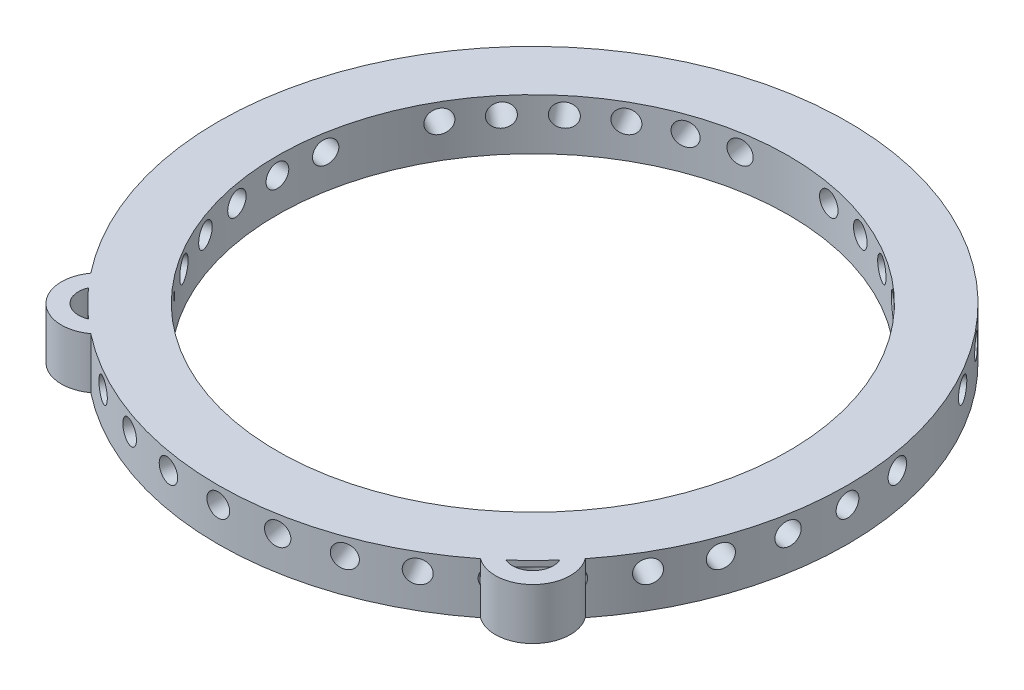
from build123d import *
from build123d.topology import SkipClean

# Parameters (mm, degrees)
CORTAR_EXTRUIR1_REACH      = 64.102
CORTAR_EXTRUIR1_END_RADIUS = 22.5
CROQUIS3_R                 = 1
MATRIZC1_COUNT             = 36
CROQUIS5_R                 = 1.8
CORTAR_EXTRUIR2_DEPTH      = 4
CROQUIS6_R                 = 3.3
CROQUIS6_R_2               = 1.8
SALIENTE_EXTRUIR1_DEPTH    = 3
SALIENTE_EXTRUIR3_START    = -4.5
CROQUIS8_R                 = 1.8
SALIENTE_EXTRUIR3_DEPTH    = 2.5


with BuildPart() as part:
    # Croquis2 → Revolución1 (revolve)
    with BuildSketch(Plane.XY, mode=Mode.PRIVATE) as revoluci_n1_sk:
        Polygon((-22.5, 0), (-22.5, 1), (-22.5, 4.5), (-27.7, 4.5), (-27.7, 0), align=None)
    revolve(revoluci_n1_sk.sketch.rotate(Axis((0, 0, 0), (0, 1, 0)), 270), axis=Axis((0, 0, 0), (0, 1, 0)))

    # Cortar-Extruir1: up to this cylinder (the profile starts outside it)
    cortar_extruir1_end = Plane(origin=(0, 3, 0), z_dir=(0, -1, 0)) * Cylinder(CORTAR_EXTRUIR1_END_RADIUS, 174.204, mode=Mode.PRIVATE)
    # Croquis3 → Cortar-Extruir1 (cut, up to the surface)
    with BuildSketch(Plane(origin=(27.7, 0, 0), x_dir=(0, 0, -1), z_dir=(1, 0, 0)), mode=Mode.PRIVATE) as cortar_extruir1_sk1:
        with Locations((0, 3)):
            Circle(CROQUIS3_R)
    cortar_extruir1_tool1 = extrude(cortar_extruir1_sk1.sketch, amount=-CORTAR_EXTRUIR1_REACH, mode=Mode.PRIVATE) - cortar_extruir1_end
    cortar_extruir1 = cortar_extruir1_tool1.solids().sort_by_distance((27.7, 3, 0))[0]
    add(cortar_extruir1, mode=Mode.SUBTRACT)

    # MatrizC1: Cortar-Extruir1 ×36 about axis
    matrizc1_axis = Axis((0, 0, 0), (0, 1, 0))
    for i in range(1, MATRIZC1_COUNT):
        add(cortar_extruir1.rotate(matrizc1_axis, i * 360 / MATRIZC1_COUNT), mode=Mode.SUBTRACT)

    # Croquis5 → Cortar-Extruir2 (cut)
    with SkipClean():  # the faces are left unmerged after this step: merging them gives an invalid solid
        with BuildSketch(Plane.XZ):
            with Locations(Location((0, -25.1, 0), (0, 0, 270))):
                Circle(CROQUIS5_R)
            with Locations(Location((-23.586284782, -8.584705597, 0), (0, 0, 270))):
                Circle(CROQUIS5_R)
            with Locations((-19.091883092, 19.091883092)):
                Circle(CROQUIS5_R)
            with Locations((19.091883092, 19.091883092)):
                Circle(CROQUIS5_R)
            with Locations(Location((23.586284782, -8.584705597, 0), (0, 0, 306.251011404))):
                Circle(CROQUIS5_R)
        extrude(amount=-CORTAR_EXTRUIR2_DEPTH, mode=Mode.SUBTRACT)

    # Croquis6 → Saliente-Extruir1 (add)
    # profile 1 of 2: a face of its own
    with SkipClean():  # the faces are left unmerged after this step: merging them gives an invalid solid
        with BuildSketch(Plane.XZ):
            with Locations((-19.091883092, 19.091883092)):
                Circle(CROQUIS6_R)
            with Locations(Location((-19.091883092, 19.091883092, 0), (0, 0, 270))):
                Circle(CROQUIS6_R_2, mode=Mode.SUBTRACT)
        # profile 2 of 2: a face of its own
        with BuildSketch(Plane.XZ):
            with Locations((19.091883092, 19.091883092)):
                Circle(CROQUIS6_R)
            with Locations(Location((19.091883092, 19.091883092, 0), (0, 0, 268.744856338))):
                Circle(CROQUIS6_R_2, mode=Mode.SUBTRACT)
        extrude(amount=-SALIENTE_EXTRUIR1_DEPTH)

    # Croquis8 → Saliente-Extruir3 (add)
    # profile 1 of 5: a face of its own
    with SkipClean():  # the faces are left unmerged after this step: merging them gives an invalid solid
        with BuildSketch(Plane.XZ.offset(SALIENTE_EXTRUIR3_START)):
            with BuildLine():
                Line((24.395457914, -5.905220838), (26.922477459, -6.516917021))
                ThreePointArc((26.922477459, -6.516917021), (26.029485596, -9.47395797), (24.812807767, -12.313186863))
                Line((24.812807767, -12.313186863), (22.48380776, -11.157436471))
                Line((22.48380776, -11.157436471), (20.154807753, -10.00168608))
                ThreePointArc((20.154807753, -10.00168608), (21.143083968, -7.695453225), (21.868438369, -5.293524656))
                Line((21.868438369, -5.293524656), (24.395457914, -5.905220838))
            make_face()
            with Locations(Location((23.586284782, -8.584705597, 0), (0, 0, 90))):
                Circle(CROQUIS8_R, mode=Mode.SUBTRACT)
        # profile 2 of 5: a face of its own
        with BuildSketch(Plane.XZ.offset(SALIENTE_EXTRUIR3_START)):
            with BuildLine():
                Line((2.794645566, -24.94393626), (3.084130765, -27.527770295))
                ThreePointArc((3.084130765, -27.527770295), (0, -27.7), (-3.084130765, -27.527770295))
                Line((-3.084130765, -27.527770295), (-2.794645566, -24.94393626))
                Line((-2.794645566, -24.94393626), (-2.505160368, -22.360102225))
                ThreePointArc((-2.505160368, -22.360102225), (0, -22.5), (2.505160368, -22.360102225))
                Line((2.505160368, -22.360102225), (2.794645566, -24.94393626))
            make_face()
            with Locations(Location((0, -25.1, 0), (0, 0, 270))):
                Circle(CROQUIS8_R, mode=Mode.SUBTRACT)
        # profile 3 of 5: a face of its own
        with BuildSketch(Plane.XZ.offset(SALIENTE_EXTRUIR3_START)):
            with BuildLine():
                Line((21.756377861, 17.14497076), (17.672148082, 13.926420293))
                ThreePointArc((17.672148082, 13.926420293), (15.909902577, 15.909902577), (13.926420293, 17.672148082))
                Line((13.926420293, 17.672148082), (17.14497076, 21.756377861))
                ThreePointArc((17.14497076, 21.756377861), (21.42533547, 21.42533547), (21.756377861, 17.14497076))
            make_face()
            with Locations(Location((19.091883092, 19.091883092, 0), (0, 0, 336.13684641))):
                Circle(CROQUIS8_R, mode=Mode.SUBTRACT)
        # profile 4 of 5: a face of its own
        with BuildSketch(Plane.XZ.offset(SALIENTE_EXTRUIR3_START)):
            with BuildLine():
                Line((-17.14497076, 21.756377861), (-13.926420293, 17.672148082))
                ThreePointArc((-13.926420293, 17.672148082), (-15.909902577, 15.909902577), (-17.672148082, 13.926420293))
                Line((-17.672148082, 13.926420293), (-21.756377861, 17.14497076))
                ThreePointArc((-21.756377861, 17.14497076), (-21.42533547, 21.42533547), (-17.14497076, 21.756377861))
            make_face()
            with Locations(Location((-19.091883092, 19.091883092, 0), (0, 0, 270))):
                Circle(CROQUIS8_R, mode=Mode.SUBTRACT)
        # profile 5 of 5: a face of its own
        with BuildSketch(Plane.XZ.offset(SALIENTE_EXTRUIR3_START)):
            with BuildLine():
                Line((-22.48380776, -11.157436471), (-20.154807753, -10.00168608))
                ThreePointArc((-20.154807753, -10.00168608), (-21.143083968, -7.695453225), (-21.868438369, -5.293524656))
                Line((-21.868438369, -5.293524656), (-24.395457914, -5.905220838))
                Line((-24.395457914, -5.905220838), (-26.922477459, -6.516917021))
                ThreePointArc((-26.922477459, -6.516917021), (-26.029485596, -9.47395797), (-24.812807767, -12.313186863))
                Line((-24.812807767, -12.313186863), (-22.48380776, -11.157436471))
            make_face()
            with Locations(Location((-23.586284782, -8.584705597, 0), (0, 0, 270))):
                Circle(CROQUIS8_R, mode=Mode.SUBTRACT)
        extrude(amount=SALIENTE_EXTRUIR3_DEPTH)


solid = part.part
